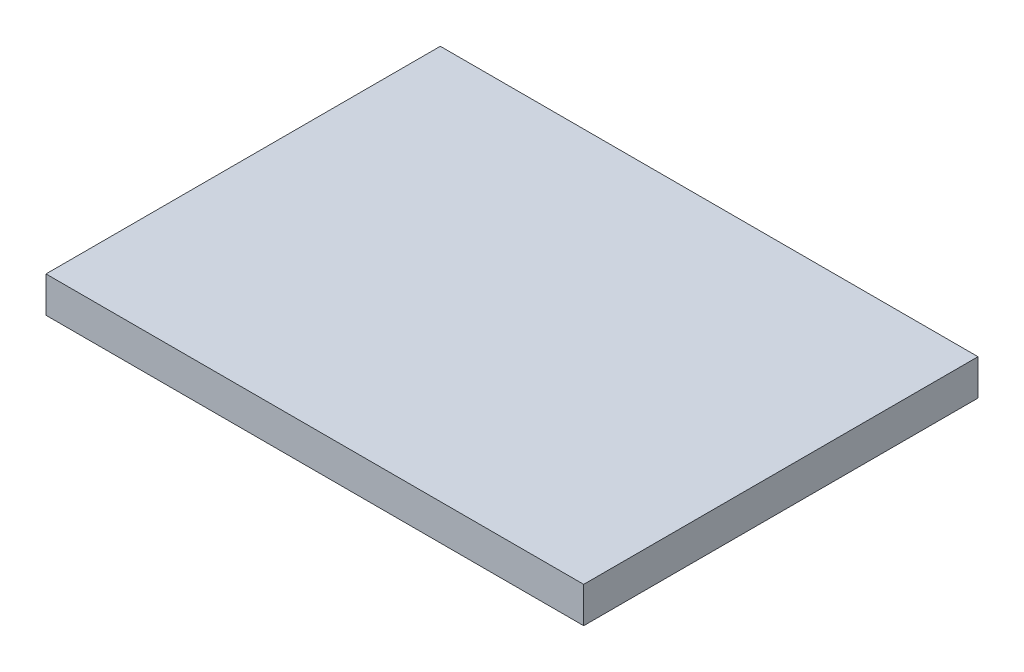
from build123d import *

# Parameters (mm, degrees)
SKETCH1_W           = 75
SKETCH1_H           = 55
BOSS_EXTRUDE1_DEPTH = 5


with BuildPart() as part:
    # Sketch1 → Boss-Extrude1 (new body)
    with BuildSketch(Plane(origin=(0, 0, 0), x_dir=(1, 0, 0), z_dir=(0, 1, 0))):
        with Locations((37.5, 0)):
            Rectangle(SKETCH1_W, SKETCH1_H)
    extrude(amount=BOSS_EXTRUDE1_DEPTH)


solid = part.part
